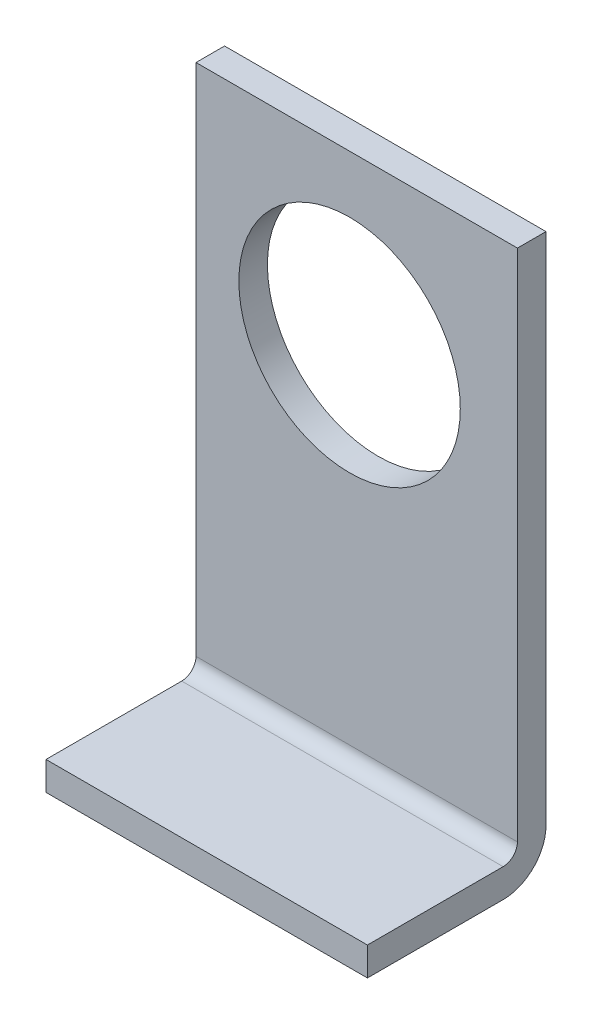
from build123d import *

# Parameters (mm, degrees)
SKETCH1_W           = 22.5
SKETCH1_H           = 12.5
BOSS_EXTRUDE1_DEPTH = 2
SKETCH2_W           = 22.5
SKETCH2_H           = 37
BOSS_EXTRUDE2_DEPTH = 2
FILLET1_R           = 1
FILLET2_R           = 3
SKETCH5_R           = 7.75
CUT_EXTRUDE1_DEPTH  = 2


with BuildPart() as part:
    # Sketch1 → Boss-Extrude1 (new body)
    with BuildSketch(Plane(origin=(0, 0, 0), x_dir=(1, 0, 0), z_dir=(0, 1, 0))):
        with Locations((11.25, 6.25)):
            Rectangle(SKETCH1_W, SKETCH1_H)
    extrude(amount=BOSS_EXTRUDE1_DEPTH)

    # Sketch2 → Boss-Extrude2 (add)
    with BuildSketch(Plane(origin=(0, 0, -12.5), x_dir=(-1, 0, 0), z_dir=(0, 0, -1))):
        with Locations((-11.25, 20.5)):
            Rectangle(SKETCH2_W, SKETCH2_H)
    extrude(amount=-BOSS_EXTRUDE2_DEPTH)

    # Fillet1
    fillet1_edges = [part.edges().sort_by_distance(p)[0] for p in [
        (11.25, 2, -10.5),
    ]]
    fillet(fillet1_edges, radius=FILLET1_R)

    # Fillet2
    fillet2_edges = [part.edges().sort_by_distance(p)[0] for p in [
        (11.25, 0, -12.5),
    ]]
    fillet(fillet2_edges, radius=FILLET2_R)

    # Sketch5 → Cut-Extrude1 (cut)
    with BuildSketch(Plane(origin=(0, 0, -12.5), x_dir=(-1, 0, 0), z_dir=(0, 0, -1))):
        with Locations((-10.75, 27.25)):
            Circle(SKETCH5_R)
    extrude(amount=-CUT_EXTRUDE1_DEPTH, mode=Mode.SUBTRACT)


solid = part.part
